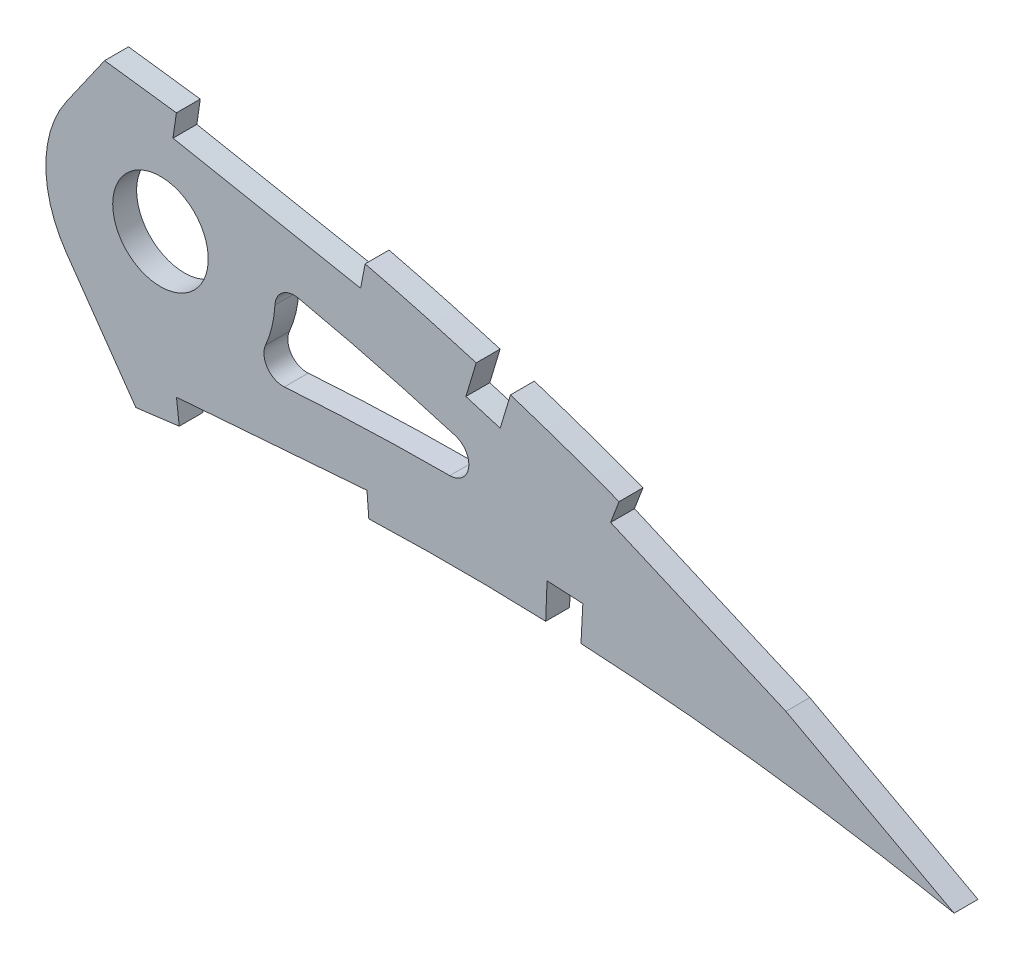
from build123d import *

# Parameters (mm, degrees)
BOSS_EXTRUDE1_DEPTH = 3.175
SKETCH3_R           = 6.35
CUT_EXTRUDE2_DEPTH  = 7.62
CUT_EXTRUDE3_DEPTH  = 391.201801695
CUT_EXTRUDE4_DEPTH  = 390.459249771
FILLET1_R           = 2.54


with BuildPart() as part:
    # Sketch1 → Boss-Extrude1 (new body)
    with BuildSketch(Plane.XY):
        with BuildLine():
            Line((383.459719795, -0.598570683), (387.151098381, -1.385981683))
            Line((387.151098381, -1.385981683), (383.938576586, 0.598570683))
            add(Edge.make_bspline(
                [(383.938576586, 0.598570683), (383.909164402, 0.616740215), (383.791629853, 0.689347806), (383.526803342, 0.851788775), (383.085812234, 1.122342517), (382.46846306, 1.499129399), (381.675235414, 1.981149322), (380.705730092, 2.565026812), (379.560552258, 3.248864764), (378.239979352, 4.02942936), (376.744146546, 4.903065392), (375.073623444, 5.866233811), (373.228555337, 6.913481558), (371.209656947, 8.040529653), (369.017620878, 9.242017712), (366.652862008, 10.5125194), (364.116227136, 11.845572217), (361.408689747, 13.235442203), (358.530743662, 14.674454529), (355.483745734, 16.156620323), (352.268711027, 17.674549225), (348.886737002, 19.220143157), (345.339766501, 20.787101279), (341.62878015, 22.365681942), (337.755892849, 23.949045726), (333.722753433, 25.528181676), (329.531749722, 27.095897536), (325.184498663, 28.642037582), (320.684250026, 30.159844956), (316.03318694, 31.639459621), (311.234635387, 33.072845765), (306.291383411, 34.45071), (301.207551835, 35.76598594), (295.986364862, 37.009095199), (290.632247735, 38.171716814), (285.149456354, 39.246851106), (279.542589067, 40.223764407), (273.827182957, 41.101695037), (268.095197614, 41.831984573), (262.375005403, 42.548231339), (256.663331957, 43.221079634), (250.881849899, 43.865424929), (245.036121341, 44.477639467), (239.131944816, 45.055808842), (233.175297421, 45.597437688), (227.172369204, 46.100937725), (221.12896887, 46.563455864), (215.051468851, 46.984279591), (208.945877574, 47.359709224), (202.818698224, 47.689463037), (196.676150699, 47.971241104), (190.524627328, 48.20310193), (184.370660154, 48.383645908), (178.220637202, 48.511143259), (172.081217377, 48.584792389), (165.95878665, 48.602580967), (159.860000816, 48.564190717), (153.791246295, 48.468303513), (147.759185686, 48.313606629), (141.770214134, 48.099811437), (135.830807778, 47.827010592), (129.947469668, 47.492919603), (124.126582163, 47.099667535), (118.374627308, 46.64560247), (112.697924861, 46.1306036), (107.102424066, 45.556817635), (101.594354639, 44.922683996), (96.179619551, 44.23000695), (90.864141437, 43.480144639), (85.653884398, 42.672688505), (80.554429795, 41.809970933), (75.571281385, 40.892874577), (70.709711341, 39.924088059), (65.975012599, 38.903864189), (61.372197101, 37.835263284), (56.906048373, 36.72014713), (52.581367423, 35.560557176), (48.402538226, 34.359275924), (44.373786491, 33.11902871), (40.499808771, 31.84117832), (36.783532955, 30.530569775), (33.229524089, 29.188133497), (29.840504666, 27.818005118), (26.620446377, 26.422055375), (23.571754691, 25.004539962), (20.697880073, 23.567072571), (18.000870717, 22.113680535), (15.483434196, 20.646592482), (13.147993867, 19.168533315), (10.995531238, 17.683252327), (9.029014018, 16.191681681), (7.249117676, 14.697590602), (5.656968684, 13.203254087), (4.254842735, 11.709701653), (3.042689485, 10.219563342), (2.022097407, 8.734019375), (1.193243635, 7.254475378), (0.55800286, 5.78200614), (0.115745172, 4.317439731), (-0.126343705, 2.862937809), (-0.186601112, 1.417334332), (-0.062107432, 0.471738862), (0, 0)],
                knots=[0, 0, 0, 0, 0.00025409, 0.001015374, 0.002283359, 0.004056577, 0.006330982, 0.009105274, 0.01237449, 0.016134024, 0.020379661, 0.025105976, 0.030306237, 0.035972206, 0.042099523, 0.048678064, 0.055701664, 0.063160184, 0.071045824, 0.079349827, 0.08806291, 0.097175757, 0.106678112, 0.116561573, 0.126814276, 0.1374283, 0.148393618, 0.15969976, 0.171338126, 0.183297699, 0.195569604, 0.208143556, 0.221011594, 0.234161831, 0.247587451, 0.261276823, 0.27522271, 0.289414144, 0.3037712, 0.317689227, 0.331784111, 0.346039677, 0.36044387, 0.374982721, 0.389640455, 0.404403317, 0.419256601, 0.43418675, 0.449177265, 0.464214782, 0.479284009, 0.49436974, 0.509457833, 0.524532346, 0.53957932, 0.554582984, 0.569529546, 0.584403417, 0.599190992, 0.613876838, 0.628447475, 0.642888675, 0.657186054, 0.671325546, 0.685294014, 0.699078148, 0.712665095, 0.726042645, 0.739197713, 0.752117587, 0.764792042, 0.777208152, 0.789355685, 0.80122396, 0.812803686, 0.824082909, 0.835054602, 0.845709571, 0.856037853, 0.866033835, 0.875688843, 0.884997719, 0.893953426, 0.902552897, 0.910789386, 0.918660734, 0.926166253, 0.933302626, 0.94007122, 0.94647478, 0.952517526, 0.958204819, 0.963546652, 0.9685566, 0.973249913, 0.977651041, 0.981787043, 0.985694226, 0.989415109, 0.993001157, 0.996508416, 1, 1, 1, 1], degree=3))
            add(Edge.make_bspline(
                [(0, 0), (0.098594067, -0.465429756), (0.296235321, -1.398428295), (0.833200827, -2.741559621), (1.543312041, -4.032697891), (2.441472641, -5.268413507), (3.521710628, -6.448368806), (4.781640288, -7.573790979), (6.220025893, -8.64407503), (7.834984953, -9.658733762), (9.624171422, -10.618844355), (11.585574313, -11.523809795), (13.717405168, -12.373347376), (16.017341357, -13.166321391), (18.482571114, -13.903939589), (21.110750633, -14.584404413), (23.898891402, -15.208666937), (26.844311765, -15.775133676), (29.943802121, -16.284380139), (33.194142548, -16.736121271), (36.59199678, -17.130639725), (40.134031288, -17.46710754), (43.816742631, -17.74624851), (47.636460203, -17.96824782), (51.589476278, -18.133809384), (55.672004278, -18.242303834), (59.880045838, -18.295422597), (64.209798061, -18.293963098), (68.657025429, -18.237535039), (73.217928944, -18.129255696), (77.888131918, -17.96843911), (82.663418096, -17.757031491), (87.53948011, -17.497160264), (92.511944666, -17.189706447), (97.576435823, -16.836032634), (102.728556211, -16.438975174), (107.9636256, -15.999524359), (113.277078315, -15.52024171), (118.664210326, -15.003526584), (124.120367239, -14.4510143), (129.640733027, -13.865303885), (135.220390799, -13.248293384), (140.854593983, -12.603274503), (146.538195749, -11.931414237), (152.266389991, -11.236548635), (158.033787934, -10.52000534), (163.835566864, -9.784544171), (169.666508639, -9.033628137), (175.521154495, -8.267171513), (181.394580274, -7.490635069), (187.28112183, -6.703379195), (193.175655329, -5.90945278), (199.072724256, -5.111323575), (204.966584816, -4.309237241), (210.852056119, -3.506517822), (216.72367834, -2.705368887), (222.575700149, -1.905863728), (228.402826975, -1.111976133), (234.199191111, -0.323609112), (239.959447702, 0.457639018), (245.678076832, 1.229436212), (251.34968319, 1.990808513), (256.968416226, 2.741274105), (262.528623029, 3.481114832), (267.941468501, 4.187874758), (273.192808754, 4.89918891), (278.300339848, 5.482308989), (283.344275668, 5.980022849), (288.329855672, 6.388079628), (293.25109327, 6.712349854), (298.102349784, 6.95515067), (302.877843519, 7.119871856), (307.571542288, 7.211400107), (312.17758361, 7.232058132), (316.689680406, 7.188433969), (321.101964205, 7.084044048), (325.408277014, 6.923573954), (329.602611012, 6.712437706), (333.679008651, 6.45639092), (337.631349997, 6.159210609), (341.4541277, 5.827834534), (345.141443703, 5.46711367), (348.687636023, 5.081169316), (352.087530269, 4.678088588), (355.335684636, 4.260525247), (358.42721331, 3.835341496), (361.357139876, 3.406846029), (364.120823945, 2.98050952), (366.713923524, 2.560399127), (369.132249836, 2.152090859), (371.372014685, 1.759399564), (373.429331453, 1.386160167), (375.301346074, 1.037081953), (376.984361404, 0.713898906), (378.476126466, 0.421937235), (379.773867448, 0.162485176), (380.875681878, -0.060801967), (381.779645661, -0.247042835), (382.484385883, -0.393180216), (382.98851051, -0.499447588), (383.291474212, -0.56268208), (383.426084821, -0.591395979), (383.459719795, -0.598570683)],
                knots=[0, 0, 0, 0, 0.003638255, 0.007293231, 0.011028136, 0.014901081, 0.018963272, 0.023258475, 0.027820626, 0.032679082, 0.03785316, 0.043361875, 0.049214679, 0.055422346, 0.061988786, 0.068918036, 0.076211157, 0.083868392, 0.091887411, 0.100265912, 0.108999867, 0.11808453, 0.127514843, 0.13728527, 0.147387918, 0.157816481, 0.168563473, 0.179619128, 0.190977373, 0.202626974, 0.214560478, 0.226767249, 0.239236417, 0.251959004, 0.264923895, 0.278119703, 0.291536035, 0.30516028, 0.318980685, 0.332985499, 0.347162791, 0.361498603, 0.375980747, 0.390597192, 0.405332594, 0.420174823, 0.435109533, 0.450124276, 0.465203068, 0.480333154, 0.495500583, 0.510689775, 0.525887335, 0.541078314, 0.556247233, 0.571381785, 0.586466041, 0.601484516, 0.616424329, 0.631269423, 0.646006524, 0.660620684, 0.675098187, 0.689422858, 0.703581825, 0.716907564, 0.730009274, 0.742952128, 0.755725558, 0.768319952, 0.780724338, 0.792926529, 0.804916041, 0.816679084, 0.828203524, 0.839474901, 0.850481359, 0.861207697, 0.871639326, 0.881763414, 0.891563605, 0.901027365, 0.910138977, 0.918883977, 0.927249278, 0.935221104, 0.942784739, 0.949928188, 0.956638465, 0.962904204, 0.968712288, 0.974054485, 0.978918432, 0.983297218, 0.987180246, 0.990560675, 0.993433358, 0.995790626, 0.997629588, 0.998945816, 0.999736593, 1, 1, 1, 1], degree=3))
        make_face()
    extrude(amount=BOSS_EXTRUDE1_DEPTH)

    # Sketch3 → Cut-Extrude2 (cut)
    with BuildSketch(Plane(origin=(0, 0, 0), x_dir=(-1, 0, 0), z_dir=(0, 0, -1))):
        with Locations((-272.41988512, 26.255421435)):
            Circle(SKETCH3_R)
    extrude(amount=-CUT_EXTRUDE2_DEPTH, mode=Mode.SUBTRACT)

    # Sketch4 → Cut-Extrude3 (cut, through all)
    with BuildSketch(Plane.XY.offset(3.175)):
        with BuildLine():
            ThreePointArc((258.636275142, 32.756936333), (259.238482127, 33.904487726), (259.936007965, 34.996726325))
            Line((259.936007965, 34.996726325), (264.993177896, 42.219113481))
            add(Edge.make_bspline(
                [(264.993177896, 42.219113481), (264.128267545, 42.326681207), (261.359885786, 42.667814769), (256.663331957, 43.221079634), (250.881849899, 43.865424929), (245.036121341, 44.477639467), (239.131944816, 45.055808842), (233.175297421, 45.597437688), (227.172369204, 46.100937725), (221.12896887, 46.563455864), (215.051468851, 46.984279591), (208.945877574, 47.359709224), (202.818698224, 47.689463037), (196.676150699, 47.971241104), (190.524627328, 48.20310193), (184.370660154, 48.383645908), (178.220637202, 48.511143259), (172.081217377, 48.584792389), (165.95878665, 48.602580967), (159.860000816, 48.564190717), (153.503835436, 48.463762379), (149.182034244, 48.349894835), (145.173898454, 48.221104496), (141.483069263, 48.086622684), (135.830807778, 47.827010592), (129.947469668, 47.492919603), (124.126582163, 47.099667535), (118.374627308, 46.64560247), (112.697924861, 46.1306036), (107.102424066, 45.556817635), (101.594354639, 44.922683996), (96.179619551, 44.23000695), (90.864141437, 43.480144639), (85.653884398, 42.672688505), (80.554429795, 41.809970933), (75.571281385, 40.892874577), (70.709711341, 39.924088059), (65.975012599, 38.903864189), (61.372197101, 37.835263284), (56.906048373, 36.72014713), (52.581367423, 35.560557176), (48.402538226, 34.359275924), (44.373786491, 33.11902871), (40.499808771, 31.84117832), (36.783532955, 30.530569775), (33.229524089, 29.188133497), (29.840504666, 27.818005118), (26.620446377, 26.422055375), (23.571754691, 25.004539962), (20.697880073, 23.567072571), (18.000870717, 22.113680535), (15.483434196, 20.646592482), (13.147993867, 19.168533315), (10.995531238, 17.683252327), (9.029014018, 16.191681681), (7.249117676, 14.697590602), (5.656968684, 13.203254087), (4.254842735, 11.709701653), (3.042689485, 10.219563342), (2.022097407, 8.734019375), (1.193243635, 7.254475378), (0.55800286, 5.78200614), (0.115745172, 4.317439731), (-0.126343705, 2.862937809), (-0.186601112, 1.417334332), (-0.062107432, 0.471738862), (0, 0)],
                knots=[0.311283457, 0.311283457, 0.311283457, 0.311283457, 0.317689227, 0.331784111, 0.346039677, 0.36044387, 0.374982721, 0.389640455, 0.404403317, 0.419256601, 0.43418675, 0.449177265, 0.464214782, 0.479284009, 0.49436974, 0.509457833, 0.524532346, 0.53957932, 0.554582984, 0.569529546, 0.584403417, 0.601303588, 0.601303588, 0.613876838, 0.628447475, 0.642888675, 0.657186054, 0.671325546, 0.685294014, 0.699078148, 0.712665095, 0.726042645, 0.739197713, 0.752117587, 0.764792042, 0.777208152, 0.789355685, 0.80122396, 0.812803686, 0.824082909, 0.835054602, 0.845709571, 0.856037853, 0.866033835, 0.875688843, 0.884997719, 0.893953426, 0.902552897, 0.910789386, 0.918660734, 0.926166253, 0.933302626, 0.94007122, 0.94647478, 0.952517526, 0.958204819, 0.963546652, 0.9685566, 0.973249913, 0.977651041, 0.981787043, 0.985694226, 0.989415109, 0.993001157, 0.996508416, 1, 1, 1, 1], degree=3))
            add(Edge.make_bspline(
                [(0, 0), (0.098594067, -0.465429756), (0.296235321, -1.398428295), (0.833200827, -2.741559621), (1.543312041, -4.032697891), (2.441472641, -5.268413507), (3.521710628, -6.448368806), (4.781640288, -7.573790979), (6.220025893, -8.64407503), (7.834984953, -9.658733762), (9.624171422, -10.618844355), (11.585574313, -11.523809795), (13.717405168, -12.373347376), (16.017341357, -13.166321391), (18.482571114, -13.903939589), (21.110750633, -14.584404413), (23.898891402, -15.208666937), (26.844311765, -15.775133676), (29.943802121, -16.284380139), (33.194142548, -16.736121271), (36.59199678, -17.130639725), (40.134031288, -17.46710754), (43.816742631, -17.74624851), (47.636460203, -17.96824782), (51.589476278, -18.133809384), (55.672004278, -18.242303834), (59.880045838, -18.295422597), (64.209798061, -18.293963098), (68.657025429, -18.237535039), (73.217928944, -18.129255696), (77.888131918, -17.96843911), (82.663418096, -17.757031491), (87.53948011, -17.497160264), (92.511944666, -17.189706447), (97.576435823, -16.836032634), (102.728556211, -16.438975174), (107.9636256, -15.999524359), (113.277078315, -15.52024171), (118.664210326, -15.003526584), (124.120367239, -14.4510143), (129.640733027, -13.865303885), (135.220390799, -13.248293384), (140.854593983, -12.603274503), (146.538195749, -11.931414237), (152.266389991, -11.236548635), (158.033787934, -10.52000534), (163.835566864, -9.784544171), (169.666508639, -9.033628137), (175.521154495, -8.267171513), (181.394580274, -7.490635069), (187.28112183, -6.703379195), (193.175655329, -5.90945278), (199.072724256, -5.111323575), (204.966584816, -4.309237241), (210.852056119, -3.506517822), (216.72367834, -2.705368887), (222.575700149, -1.905863728), (228.402826975, -1.111976133), (234.199191111, -0.323609112), (239.959447702, 0.457639018), (245.678076832, 1.229436212), (251.34968319, 1.990808513), (256.968416226, 2.741274105), (262.528623029, 3.481114832), (266.583838647, 4.010607851), (268.783690281, 4.304486241), (269.151142409, 4.353540657)],
                knots=[0, 0, 0, 0, 0.003638255, 0.007293231, 0.011028136, 0.014901081, 0.018963272, 0.023258475, 0.027820626, 0.032679082, 0.03785316, 0.043361875, 0.049214679, 0.055422346, 0.061988786, 0.068918036, 0.076211157, 0.083868392, 0.091887411, 0.100265912, 0.108999867, 0.11808453, 0.127514843, 0.13728527, 0.147387918, 0.157816481, 0.168563473, 0.179619128, 0.190977373, 0.202626974, 0.214560478, 0.226767249, 0.239236417, 0.251959004, 0.264923895, 0.278119703, 0.291536035, 0.30516028, 0.318980685, 0.332985499, 0.347162791, 0.361498603, 0.375980747, 0.390597192, 0.405332594, 0.420174823, 0.435109533, 0.450124276, 0.465203068, 0.480333154, 0.495500583, 0.510689775, 0.525887335, 0.541078314, 0.556247233, 0.571381785, 0.586466041, 0.601484516, 0.616424329, 0.631269423, 0.646006524, 0.660620684, 0.675098187, 0.689422858, 0.703581825, 0.706421091, 0.706421091, 0.706421091, 0.706421091], degree=3))
            Line((269.151142409, 4.353540657), (262.583654743, 13.732885077))
            Line((262.583654743, 13.732885077), (259.936007965, 17.514116545))
            ThreePointArc((259.936007965, 17.514116545), (257.234987727, 24.960627569), (258.636275142, 32.756936333))
        make_face()
        with BuildLine():
            add(Edge.make_bspline(
                [(327.549181489, 16.98603205), (326.824956948, 17.255063713), (321.470908621, 19.218235632), (311.379208006, 22.563584273), (298.702483107, 26.00149194), (290.712241282, 27.773311637), (287.505134836, 28.421718046)],
                knots=[0.144436945, 0.144436945, 0.144436945, 0.144436945, 0.150325897, 0.187907371, 0.225488845, 0.250466936, 0.250466936, 0.250466936, 0.250466936], degree=3))
            ThreePointArc((287.505134836, 28.421718046), (287.03032262, 21.920364799), (283.882435702, 16.212138398))
            add(Edge.make_bspline(
                [(283.882435702, 16.212138398), (284.380055625, 16.254830388), (287.276976077, 16.496512621), (292.572797624, 16.8640824), (302.188464838, 17.315929241), (313.854957689, 17.470710505), (323.107860186, 17.20273134), (327.549181489, 16.98603205)],
                knots=[0.746492785, 0.746492785, 0.746492785, 0.746492785, 0.75019431, 0.768037574, 0.785880837, 0.821567364, 0.854595374, 0.854595374, 0.854595374, 0.854595374], degree=3))
        make_face()
    extrude(amount=-CUT_EXTRUDE3_DEPTH, mode=Mode.SUBTRACT)

    # Sketch5 → Cut-Extrude4 (cut, through all)
    with BuildSketch(Plane.XY.offset(3.175)):
        with BuildLine():
            add(Edge.make_bspline(
                [(299.624398141, 36.13644563), (298.424501349, 36.426858934), (295.444247173, 37.126813532), (290.632247735, 38.171716814), (285.149456354, 39.246851106), (279.770936215, 40.18397831), (276.216351623, 40.734415073), (274.534483108, 40.97601376)],
                knots=[0.225088548, 0.225088548, 0.225088548, 0.225088548, 0.234161831, 0.247587451, 0.261276823, 0.27522271, 0.287710696, 0.287710696, 0.287710696, 0.287710696], degree=3))
            Line((274.534483108, 40.97601376), (274.083031687, 37.833273457))
            Line((274.083031687, 37.833273457), (299.022613693, 33.018997879))
            Line((299.022613693, 33.018997879), (299.624398141, 36.13644563))
        make_face()
        with BuildLine():
            add(Edge.make_bspline(
                [(274.917358333, 5.090268039), (276.051562825, 5.224103371), (278.866167352, 5.53814241), (283.344275668, 5.980022849), (288.329855672, 6.388079628), (293.25109327, 6.712349854), (297.172305481, 6.908602829), (299.45218138, 6.997517141), (300.113766812, 7.021215382)],
                knots=[0.721262157, 0.721262157, 0.721262157, 0.721262157, 0.730009274, 0.742952128, 0.755725558, 0.768319952, 0.780724338, 0.785794655, 0.785794655, 0.785794655, 0.785794655], degree=3))
            Line((300.113766812, 7.021215382), (299.870827414, 10.18690732))
            Line((299.870827414, 10.18690732), (274.545291907, 8.243392136))
            Line((274.545291907, 8.243392136), (274.917358333, 5.090268039))
        make_face()
        with BuildLine():
            add(Edge.make_bspline(
                [(323.625046444, 6.987464809), (324.231568894, 6.964251695), (325.795034786, 6.900013286), (327.358005414, 6.824525333), (328.314492602, 6.774166864)],
                knots=[0.845832607, 0.845832607, 0.845832607, 0.845832607, 0.850481359, 0.857817238, 0.857817238, 0.857817238, 0.857817238], degree=3))
            Line((328.314492602, 6.774166864), (328.563098706, 11.496084697))
            Line((328.563098706, 11.496084697), (323.807185741, 11.746480623))
            Line((323.807185741, 11.746480623), (323.625046444, 6.987464809))
        make_face()
        with BuildLine():
            Line((333.382575061, 25.646158956), (332.25138626, 22.679504798))
            Line((332.25138626, 22.679504798), (355.560182174, 12.586931637))
            Line((355.560182174, 12.586931637), (377.916781847, 0.531125937))
            Line((377.916781847, 0.531125937), (379.538106568, 3.260948486))
            add(Edge.make_bspline(
                [(379.538106568, 3.260948486), (379.124721487, 3.506470471), (378.213445898, 4.044926133), (376.744146546, 4.903065392), (375.073623444, 5.866233811), (373.228555337, 6.913481558), (371.209656947, 8.040529653), (369.017620878, 9.242017712), (366.652862008, 10.5125194), (364.116227136, 11.845572217), (361.408689747, 13.235442203), (358.530743662, 14.674454529), (355.483745734, 16.156620323), (352.268711027, 17.674549225), (348.886737002, 19.220143157), (345.339766501, 20.787101279), (341.62878015, 22.365681942), (337.755892849, 23.949045726), (334.985526139, 25.033755481), (333.509547657, 25.597744153), (333.382575061, 25.646158956)],
                knots=[0.012600324, 0.012600324, 0.012600324, 0.012600324, 0.016134024, 0.020379661, 0.025105976, 0.030306237, 0.035972206, 0.042099523, 0.048678064, 0.055701664, 0.063160184, 0.071045824, 0.079349827, 0.08806291, 0.097175757, 0.106678112, 0.116561573, 0.126814276, 0.1374283, 0.13842703, 0.13842703, 0.13842703, 0.13842703], degree=3))
        make_face()
        with BuildLine():
            add(Edge.make_bspline(
                [(318.940828887, 30.710119476), (317.985349351, 31.016233704), (316.470853017, 31.492443021), (314.952360948, 31.955704373), (314.392994499, 32.124427397)],
                knots=[0.175923769, 0.175923769, 0.175923769, 0.175923769, 0.183297699, 0.187591729, 0.187591729, 0.187591729, 0.187591729], degree=3))
            Line((314.392994499, 32.124427397), (313.017673371, 27.564833331))
            Line((313.017673371, 27.564833331), (317.577267437, 26.189512203))
            Line((317.577267437, 26.189512203), (318.940828887, 30.710119476))
        make_face()
    extrude(amount=-CUT_EXTRUDE4_DEPTH, mode=Mode.SUBTRACT)


with BuildPart() as cut_extrude4_kept_piece:
    # of the separate pieces the step leaves, the one the design keeps (cut_extrude4_pieces_kept)
    add(part.part.solids().sort_by_distance((328.314492602, 6.774166864, 0))[0])

    # Fillet1
    fillet1_edges = [cut_extrude4_kept_piece.edges().sort_by_distance(p)[0] for p in [
        (327.549181489, 16.98603205, 1.5875),
        (287.505134836, 28.421718046, 1.5875),
        (283.882435702, 16.212138398, 1.5875),
    ]]
    fillet(fillet1_edges, radius=FILLET1_R)


solid = cut_extrude4_kept_piece.part
